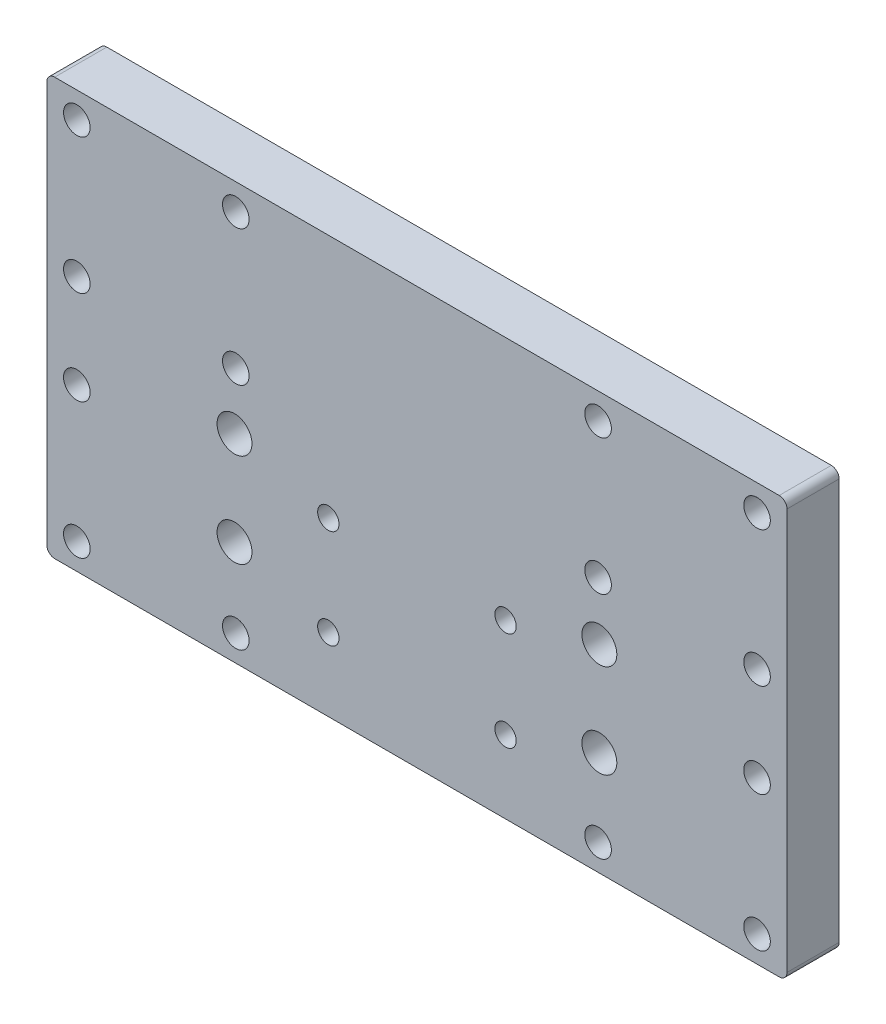
from build123d import *

# Parameters (mm, degrees)
SKETCH1_W           = 142
SKETCH1_H           = 80
BOSS_EXTRUDE1_DEPTH = 5
SKETCH2_R           = 2.55
CUT_EXTRUDE1_DEPTH  = 83.1035931
SKETCH3_R           = 2.05
CUT_EXTRUDE2_DEPTH  = 83.1035931
SKETCH4_R           = 3.35
CUT_EXTRUDE3_DEPTH  = 83.1035931
FILLET1_R           = 1.5


with BuildPart() as part:
    # Sketch1 → Boss-Extrude1 (new, symmetric)
    with BuildSketch(Plane.XY):
        Rectangle(SKETCH1_W, SKETCH1_H)
    extrude(amount=BOSS_EXTRUDE1_DEPTH, both=True)

    # Sketch2 → Cut-Extrude1 (cut, through all)
    with BuildSketch(Plane.XY.offset(5)):
        with Locations((-65.25, 35)):
            Circle(SKETCH2_R)
        with Locations((-34.75, 35)):
            Circle(SKETCH2_R)
        with Locations((-34.75, 9)):
            Circle(SKETCH2_R)
        with Locations((-65.25, 9)):
            Circle(SKETCH2_R)
        with Locations((65.25, 35)):
            Circle(SKETCH2_R)
        with Locations((65.25, 9)):
            Circle(SKETCH2_R)
        with Locations((34.75, 9)):
            Circle(SKETCH2_R)
        with Locations((34.75, 35)):
            Circle(SKETCH2_R)
        with Locations((-65.25, -9)):
            Circle(SKETCH2_R)
        with Locations((-34.75, -35)):
            Circle(SKETCH2_R)
        with Locations((-65.25, -35)):
            Circle(SKETCH2_R)
        with Locations((65.25, -9)):
            Circle(SKETCH2_R)
        with Locations((65.25, -35)):
            Circle(SKETCH2_R)
        with Locations((34.75, -35)):
            Circle(SKETCH2_R)
    extrude(amount=-CUT_EXTRUDE1_DEPTH, mode=Mode.SUBTRACT)

    # Sketch3 → Cut-Extrude2 (cut, through all)
    with BuildSketch(Plane.XY.offset(5)):
        with Locations((-17, -7)):
            Circle(SKETCH3_R)
        with Locations((-17, -26)):
            Circle(SKETCH3_R)
        with Locations((17, -26)):
            Circle(SKETCH3_R)
        with Locations((17, -7)):
            Circle(SKETCH3_R)
    extrude(amount=-CUT_EXTRUDE2_DEPTH, mode=Mode.SUBTRACT)

    # Sketch4 → Cut-Extrude3 (cut, through all)
    with BuildSketch(Plane.XY.offset(5)):
        with Locations((-35, -2)):
            Circle(SKETCH4_R)
        with Locations((35, -2)):
            Circle(SKETCH4_R)
        with Locations((35, -20)):
            Circle(SKETCH4_R)
        with Locations((-35, -20)):
            Circle(SKETCH4_R)
    extrude(amount=-CUT_EXTRUDE3_DEPTH, mode=Mode.SUBTRACT)

    # Fillet1
    fillet1_edges = [part.edges().sort_by_distance(p)[0] for p in [
        (-71, -40, 0),
        (71, -40, 0),
        (71, 40, 0),
        (-71, 40, 0),
    ]]
    fillet(fillet1_edges, radius=FILLET1_R)


solid = part.part
